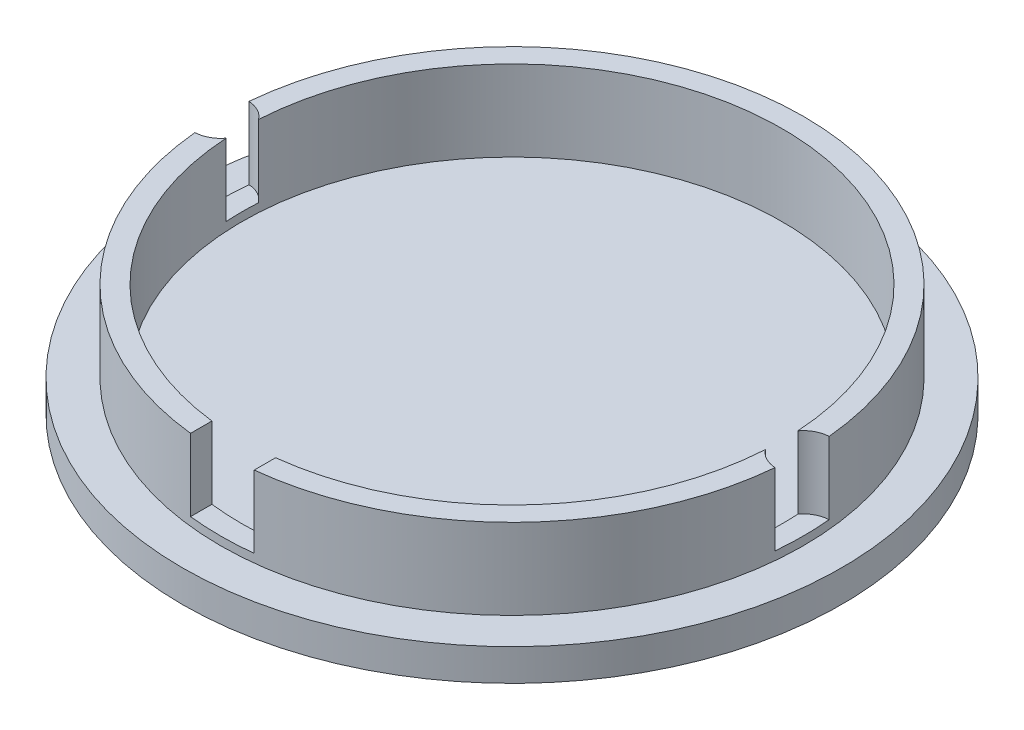
from build123d import *

# Parameters (mm, degrees)
SKETCH1_R           = 31.06
BOSS_EXTRUDE1_DEPTH = 3
SKETCH2_R           = 27.46
SKETCH2_R_2         = 25.46
BOSS_EXTRUDE2_DEPTH = 7.6
CUT_EXTRUDE1_START  = -6.8
CUT_EXTRUDE1_DEPTH  = 6.8
CUT_EXTRUDE2_START  = -6.8
CUT_EXTRUDE2_DEPTH  = 6.8


with BuildPart() as part:
    # Sketch1 → Boss-Extrude1 (new body)
    with BuildSketch(Plane(origin=(0, 0, 0), x_dir=(1, 0, 0), z_dir=(0, 1, 0))):
        Circle(SKETCH1_R)
    extrude(amount=BOSS_EXTRUDE1_DEPTH)

    # Sketch2 → Boss-Extrude2 (add)
    with BuildSketch(Plane(origin=(0, 3, 0), x_dir=(1, 0, 0), z_dir=(0, 1, 0))):
        Circle(SKETCH2_R)
        Circle(SKETCH2_R_2, mode=Mode.SUBTRACT)
    extrude(amount=BOSS_EXTRUDE2_DEPTH)

    # Sketch4 → Cut-Extrude1 (cut)
    with BuildSketch(Plane(origin=(0, 10.6, 0), x_dir=(1, 0, 0), z_dir=(0, 1, 0)).offset(CUT_EXTRUDE1_START)):
        with BuildLine():
            ThreePointArc((25.414433722, 1.522550032), (25.46, 0), (25.414433722, -1.522550032))
            ThreePointArc((25.414433722, -1.522550032), (26.262841127, -2.251512965), (27.34160051, -2.547249803))
            ThreePointArc((27.34160051, -2.547249803), (27.46, 0), (27.34160051, 2.547249803))
            ThreePointArc((27.34160051, 2.547249803), (26.262841127, 2.251512965), (25.414433722, 1.522550032))
        make_face()
        with BuildLine():
            ThreePointArc((-27.34160051, -2.547249803), (-26.262841127, -2.251512965), (-25.414433722, -1.522550032))
            ThreePointArc((-25.414433722, -1.522550032), (-25.46, 0), (-25.414433722, 1.522550032))
            ThreePointArc((-25.414433722, 1.522550032), (-26.262841127, 2.251512965), (-27.34160051, 2.547249803))
            ThreePointArc((-27.34160051, 2.547249803), (-27.46, 0), (-27.34160051, -2.547249803))
        make_face()
    extrude(amount=CUT_EXTRUDE1_DEPTH, mode=Mode.SUBTRACT)

    # Sketch5 → Cut-Extrude2 (cut)
    with BuildSketch(Plane(origin=(0, 10.6, 0), x_dir=(1, 0, 0), z_dir=(0, 1, 0)).offset(CUT_EXTRUDE2_START)):
        with BuildLine():
            ThreePointArc((3, -25.282634356), (0, -25.46), (-3, -25.282634356))
            Line((-3, -25.282634356), (-3, -27.29563335))
            ThreePointArc((-3, -27.29563335), (0, -27.46), (3, -27.29563335))
            Line((3, -27.29563335), (3, -25.282634356))
        make_face()
    extrude(amount=CUT_EXTRUDE2_DEPTH, mode=Mode.SUBTRACT)


solid = part.part
